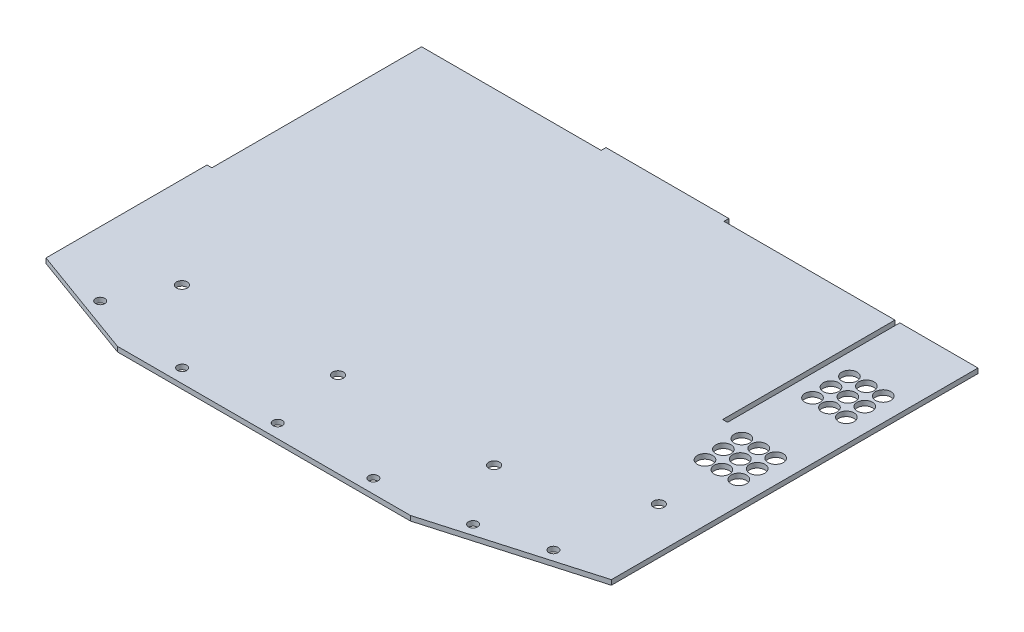
from build123d import *

# Parameters (mm, degrees)
SKETCH1_W               = 308.1112
SKETCH1_H               = 3.175
BOSS_EXTRUDE1_DEPTH     = 267.83
SKETCH3_W               = 155.702
SKETCH3_H               = 3.175
BOSS_EXTRUDE3_DEPTH     = 3.175
SKETCH4_W               = 50.87366
SKETCH4_H               = 3.175
BOSS_EXTRUDE4_DEPTH     = 267.83
CUT_EXTRUDE1_DEPTH      = 340.190761306
CUT_EXTRUDE3_DEPTH      = 340.190761306
SKETCH13_R              = 5
CUT_EXTRUDE4_DEPTH      = 340.190761306
LPATTERN1_COUNT         = 3
LPATTERN1_PITCH         = 12
SKETCH17_W              = 105.930619964
SKETCH17_H              = 3.175
BOSS_EXTRUDE5_DEPTH     = 3.175
SKETCH18_W              = 80
SKETCH18_H              = 3.175
BOSS_EXTRUDE6_DEPTH     = 3.175
CUT_EXTRUDE7_DEPTH      = 340.190761306
CUT_EXTRUDE7_DEPTH_BACK = 340.190761306
SKETCH25_R              = 3
CUT_EXTRUDE8_DEPTH      = 3.175
M6_CLEARANCE_HOLE1_D    = 7
M6_CLEARANCE_HOLE2_D    = 7


with BuildPart() as part:
    # Sketch1 → Boss-Extrude1 (new body)
    with BuildSketch(Plane.XY):
        Rectangle(SKETCH1_W, SKETCH1_H)
    extrude(amount=BOSS_EXTRUDE1_DEPTH)

    # Sketch3 → Boss-Extrude3 (add)
    with BuildSketch(Plane(origin=(154.0556, 0, 0), x_dir=(0, 0, -1), z_dir=(1, 0, 0))):
        with Locations((-189.979, 0)):
            Rectangle(SKETCH3_W, SKETCH3_H)
    extrude(amount=BOSS_EXTRUDE3_DEPTH)

    # Sketch4 → Boss-Extrude4 (add)
    with BuildSketch(Plane.XY.offset(267.83)):
        with Locations((182.66743, 0)):
            Rectangle(SKETCH4_W, SKETCH4_H)
    extrude(amount=-BOSS_EXTRUDE4_DEPTH)

    # Sketch6 → Cut-Extrude1 (cut, through all)
    with BuildSketch(Plane(origin=(0, 1.5875, 0), x_dir=(1, 0, 0), z_dir=(0, 1, 0))):
        Polygon((208.10426, -238.620139294), (106.50426, -267.83), (208.10426, -267.83), align=None)
    extrude(amount=-CUT_EXTRUDE1_DEPTH, mode=Mode.SUBTRACT)

    # Sketch11 → Cut-Extrude3 (cut, through all)
    with BuildSketch(Plane.XZ.offset(1.5875)):
        Polygon((-154.0556, 242.43), (-84.2056, 267.83), (-154.0556, 267.83), align=None)
    extrude(amount=-CUT_EXTRUDE3_DEPTH, mode=Mode.SUBTRACT)

    # Sketch13 → Cut-Extrude4 (cut, through all)
    with BuildSketch(Plane.XZ.offset(1.5875)):
        with Locations((171.04991, 116.644763656)):
            Circle(SKETCH13_R)
        with Locations((182.04991, 116.644763656)):
            Circle(SKETCH13_R)
        with Locations((193.04991, 116.644763656)):
            Circle(SKETCH13_R)
        with Locations((171.04991, 46.644823778)):
            Circle(SKETCH13_R)
        with Locations((182.04991, 46.644823778)):
            Circle(SKETCH13_R)
        with Locations((193.04991, 46.644823778)):
            Circle(SKETCH13_R)
    cut_extrude4 = extrude(amount=-CUT_EXTRUDE4_DEPTH, mode=Mode.SUBTRACT)

    # LPattern1: Cut-Extrude4 ×3
    with Locations(*[(0, 0, i * LPATTERN1_PITCH) for i in range(1, LPATTERN1_COUNT)]):
        add(cut_extrude4, mode=Mode.SUBTRACT)

    # Sketch17 → Boss-Extrude5 (add)
    with BuildSketch(Plane.ZY.offset(154.0556)):
        with Locations((189.464690018, 0)):
            Rectangle(SKETCH17_W, SKETCH17_H)
    extrude(amount=BOSS_EXTRUDE5_DEPTH)

    # Sketch18 → Boss-Extrude6 (add)
    with BuildSketch(Plane(origin=(0, 0, 0), x_dir=(-1, 0, 0), z_dir=(0, 0, -1))):
        with Locations((-2.78399998, 0)):
            Rectangle(SKETCH18_W, SKETCH18_H)
    extrude(amount=BOSS_EXTRUDE6_DEPTH)

    # Sketch23 → Cut-Extrude7 (cut, two sides: drawn at the far end of the back side and taken through both)
    with BuildSketch(Plane(origin=(0, 1.5875, 0), x_dir=(1, 0, 0), z_dir=(0, 1, 0)).offset(-CUT_EXTRUDE7_DEPTH_BACK)):
        Polygon((681.560448342, -546.290381215), (-154.0556, -242.43), (-157.2306, -241.275454545), (-992.846648342, 62.58492667), (-1600.567410773, -1608.647170014), (73.839685911, -2217.5224779), align=None)
    extrude(amount=CUT_EXTRUDE7_DEPTH + CUT_EXTRUDE7_DEPTH_BACK, mode=Mode.SUBTRACT)

    # Sketch25 → Cut-Extrude8 (cut)
    with BuildSketch(Plane.XZ.offset(1.5875)):
        with Locations((-115.3206, 247.915394364)):
            Circle(SKETCH25_R)
        with Locations((-50.97574, 258.94)):
            Circle(SKETCH25_R)
        with Locations((11.25426, 258.94)):
            Circle(SKETCH25_R)
        with Locations((73.48426, 258.94)):
            Circle(SKETCH25_R)
        with Locations((172.54426, 240.761310541)):
            Circle(SKETCH25_R)
        with Locations((131.90426, 252.445254824)):
            Circle(SKETCH25_R)
    extrude(amount=-CUT_EXTRUDE8_DEPTH, mode=Mode.SUBTRACT)

    # M6 Clearance Hole1 (through all)
    with Locations(Plane.XZ.offset(1.5875)):
        with Locations((180.96500002, 180.586)):
            Hole(M6_CLEARANCE_HOLE1_D / 2)

    # M6 Clearance Hole2 (through all)
    with Locations(Plane(origin=(0, -1.5875, 0), x_dir=(-1, 0, 0), z_dir=(0, -1, 0))):
        with Locations((97.77095, -212.2849914), (-3.82905, -212.2849914), (-105.42905, -212.2849914)):
            Hole(M6_CLEARANCE_HOLE2_D / 2)


solid = part.part
